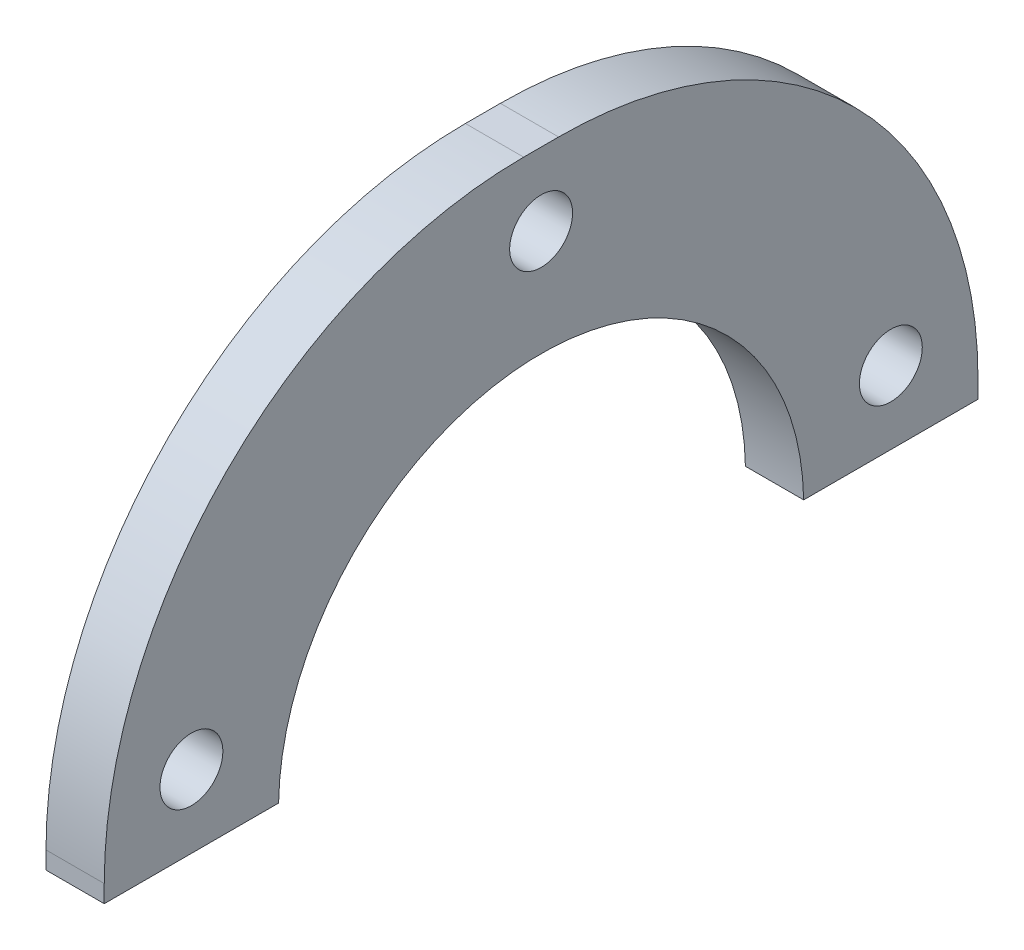
from build123d import *

# Parameters (mm, degrees)
SKETCH1_W                        = 47.625
SKETCH1_H                        = 23.8125
BOSS_EXTRUDE1_DEPTH              = 3.175
SKETCH2_R                        = 14.3129
CUT_EXTRUDE1_DEPTH               = 27.811836385
F_1_8_0_135_DIAMETER_HOLE1_D     = 3.429
F_1_8_0_135_DIAMETER_HOLE1_DEPTH = 19.001994
F_1_8_0_135_DIAMETER_HOLE1_TIP   = 1.030175531
FILLET1_R                        = 22.86


with BuildPart() as part:
    # Sketch1 → Boss-Extrude1 (new body)
    with BuildSketch(Plane(origin=(0, 0, 0), x_dir=(0, 0, -1), z_dir=(1, 0, 0))):
        Rectangle(SKETCH1_W, SKETCH1_H)
    extrude(amount=BOSS_EXTRUDE1_DEPTH)

    # Sketch2 → Cut-Extrude1 (cut, through all)
    with BuildSketch(Plane(origin=(3.175, 0, 0), x_dir=(0, 0, -1), z_dir=(1, 0, 0))):
        with Locations((0, -12.16025)):
            Circle(SKETCH2_R)
    extrude(amount=-CUT_EXTRUDE1_DEPTH, mode=Mode.SUBTRACT)

    # 1/8 (0.135) Diameter Hole1
    with Locations(Plane(origin=(3.175, 0, 0), x_dir=(0, 0, -1), z_dir=(1, 0, 0))):
        with Locations((-19.061573026, -7.9375), (0, 7.9375), (19.061573026, -7.9375)):
            Hole(F_1_8_0_135_DIAMETER_HOLE1_D / 2, depth=F_1_8_0_135_DIAMETER_HOLE1_DEPTH)
            with Locations((0, 0, -(F_1_8_0_135_DIAMETER_HOLE1_DEPTH + F_1_8_0_135_DIAMETER_HOLE1_TIP / 2))):  # 118° drill point
                Cone(0, F_1_8_0_135_DIAMETER_HOLE1_D / 2, F_1_8_0_135_DIAMETER_HOLE1_TIP, mode=Mode.SUBTRACT)

    # Fillet1
    fillet1_edges = [part.edges().sort_by_distance(p)[0] for p in [
        (1.5875, 11.90625, -23.8125),
        (1.5875, 11.90625, 23.8125),
    ]]
    fillet(fillet1_edges, radius=FILLET1_R)


solid = part.part
